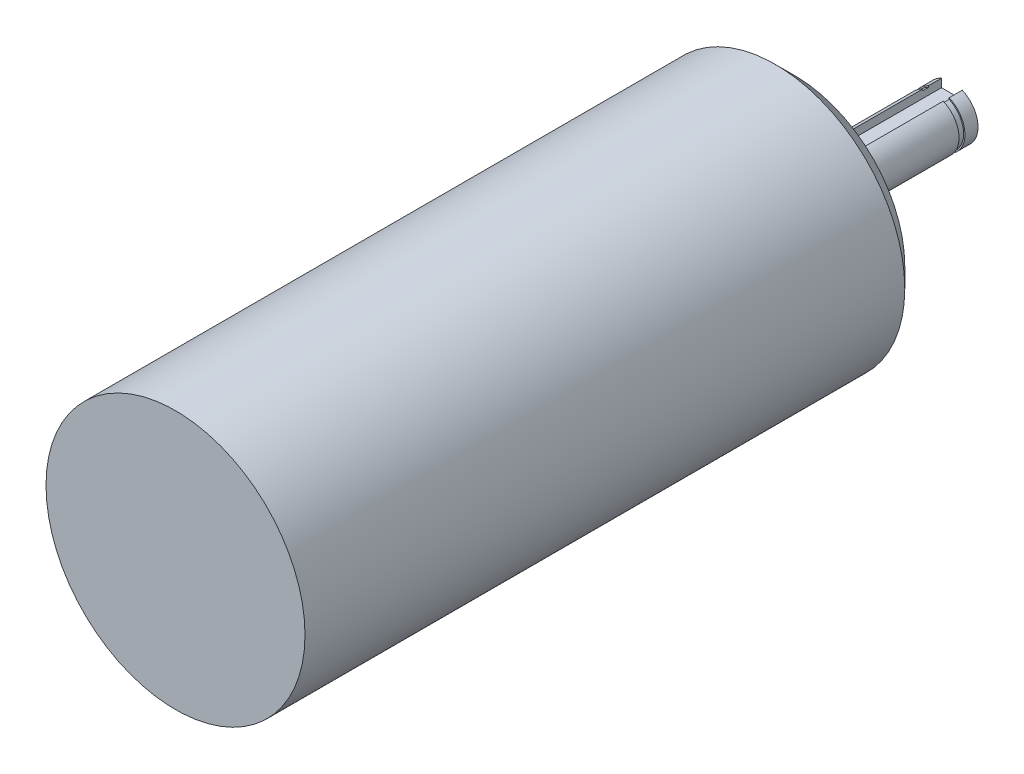
from build123d import *

# Parameters (mm, degrees)
SKETCH1_R                       = 19.8
BOSS_EXTRUDE1_DEPTH             = 94.7
M4X0_7_TAPPED_HOLE1_D           = 3.3
M4X0_7_TAPPED_HOLE1_DEPTH       = 4
M4X0_7_TAPPED_HOLE1_CSINK_D     = 4.05
M4X0_7_TAPPED_HOLE1_CSINK_ANGLE = 90
M4X0_7_TAPPED_HOLE1_TIP         = 0.991420021
SKETCH6_R                       = 4
BOSS_EXTRUDE2_DEPTH             = 24
CHAMFER1_SIZE                   = 3
SKETCH7_W                       = 3.175
SKETCH7_H                       = 3.175
CUT_EXTRUDE1_DEPTH              = 16
CUT_EXTRUDE2_START              = -0.9
SKETCH8_R                       = 4
SKETCH8_R_2                     = 3.8
CUT_EXTRUDE2_DEPTH              = 0.9


with BuildPart() as part:
    # Sketch1 → Boss-Extrude1 (new body)
    with BuildSketch(Plane.XY):
        Circle(SKETCH1_R)
    extrude(amount=BOSS_EXTRUDE1_DEPTH)

    # M4x0.7 Tapped Hole1
    with Locations(Plane(origin=(0, 0, 0), x_dir=(-1, 0, 0), z_dir=(0, 0, -1))):
        with Locations((0, 12.5), (-12.5, 0), (0, -12.5), (12.5, 0)):
            CounterSinkHole(M4X0_7_TAPPED_HOLE1_D / 2, M4X0_7_TAPPED_HOLE1_CSINK_D / 2, depth=M4X0_7_TAPPED_HOLE1_DEPTH, counter_sink_angle=M4X0_7_TAPPED_HOLE1_CSINK_ANGLE)
            with Locations((0, 0, -(M4X0_7_TAPPED_HOLE1_DEPTH + M4X0_7_TAPPED_HOLE1_TIP / 2))):  # 118° drill point
                Cone(0, M4X0_7_TAPPED_HOLE1_D / 2, M4X0_7_TAPPED_HOLE1_TIP, mode=Mode.SUBTRACT)

    # Sketch6 → Boss-Extrude2 (add)
    with BuildSketch(Plane(origin=(0, 0, 0), x_dir=(-1, 0, 0), z_dir=(0, 0, -1))):
        Circle(SKETCH6_R)
    extrude(amount=BOSS_EXTRUDE2_DEPTH)

    # Chamfer1
    chamfer1_edges = [part.edges().sort_by_distance(p)[0] for p in [
        (-19.8, 0, 0),
    ]]
    chamfer(chamfer1_edges, length=CHAMFER1_SIZE)

    # Sketch7 → Cut-Extrude1 (cut)
    with BuildSketch(Plane(origin=(0, 0, -24), x_dir=(-1, 0, 0), z_dir=(0, 0, -1))):
        with Locations((0, 4)):
            Rectangle(SKETCH7_W, SKETCH7_H)
    extrude(amount=-CUT_EXTRUDE1_DEPTH, mode=Mode.SUBTRACT)

    # Sketch8 → Cut-Extrude2 (cut)
    with BuildSketch(Plane(origin=(0, 0, -22), x_dir=(-1, 0, 0), z_dir=(0, 0, -1)).offset(CUT_EXTRUDE2_START)):
        Circle(SKETCH8_R)
        Circle(SKETCH8_R_2, mode=Mode.SUBTRACT)
    extrude(amount=CUT_EXTRUDE2_DEPTH, mode=Mode.SUBTRACT)


solid = part.part
